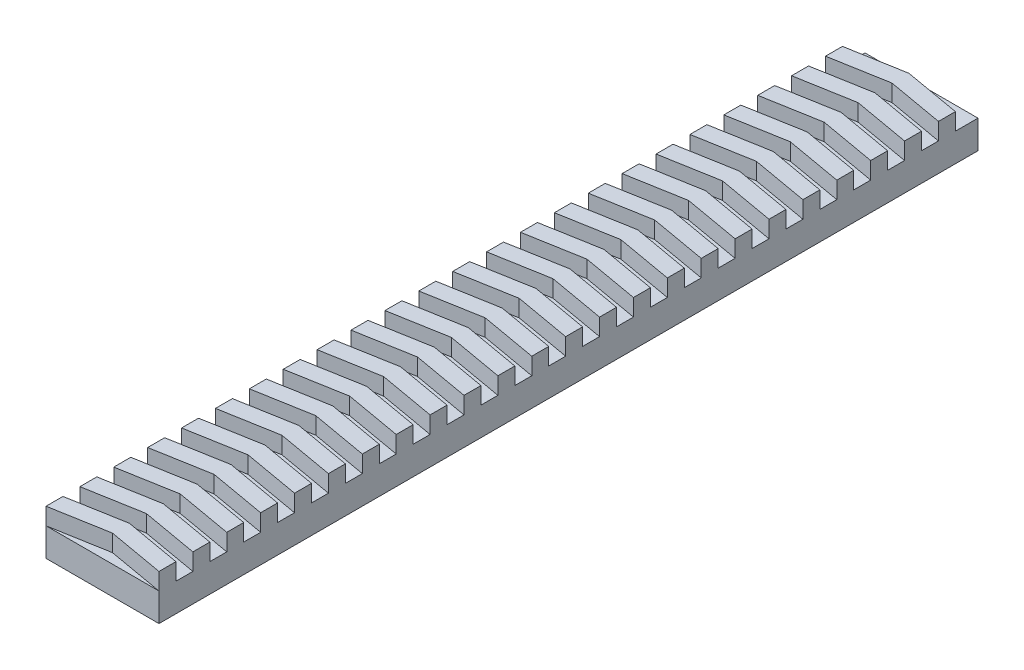
from build123d import *

# Parameters (mm, degrees)
SKETCH2_W           = 20
SKETCH2_H           = 145
BOSS_EXTRUDE1_DEPTH = 5
BOSS_EXTRUDE2_DEPTH = 3
LPATTERN1_COUNT     = 24
LPATTERN1_PITCH     = 6


with BuildPart() as part:
    # Sketch2 → Boss-Extrude1 (new body)
    with BuildSketch(Plane(origin=(0, 0, 0), x_dir=(1, 0, 0), z_dir=(0, 1, 0))):
        Rectangle(SKETCH2_W, SKETCH2_H)
    extrude(amount=BOSS_EXTRUDE1_DEPTH)

    # Sketch3 → Boss-Extrude2 (add)
    with BuildSketch(Plane(origin=(0, 5, 0), x_dir=(1, 0, 0), z_dir=(0, 1, 0))):
        Polygon((-10, -72.5), (0, -70.736730193), (10, -72.5), (10, -69.5), (0, -67.736730193), (-10, -69.5), align=None)
    boss_extrude2 = extrude(amount=BOSS_EXTRUDE2_DEPTH)

    # LPattern1: Boss-Extrude2 ×24
    with Locations(*[(0, 0, -i * LPATTERN1_PITCH) for i in range(1, LPATTERN1_COUNT)]):
        add(boss_extrude2)


solid = part.part
